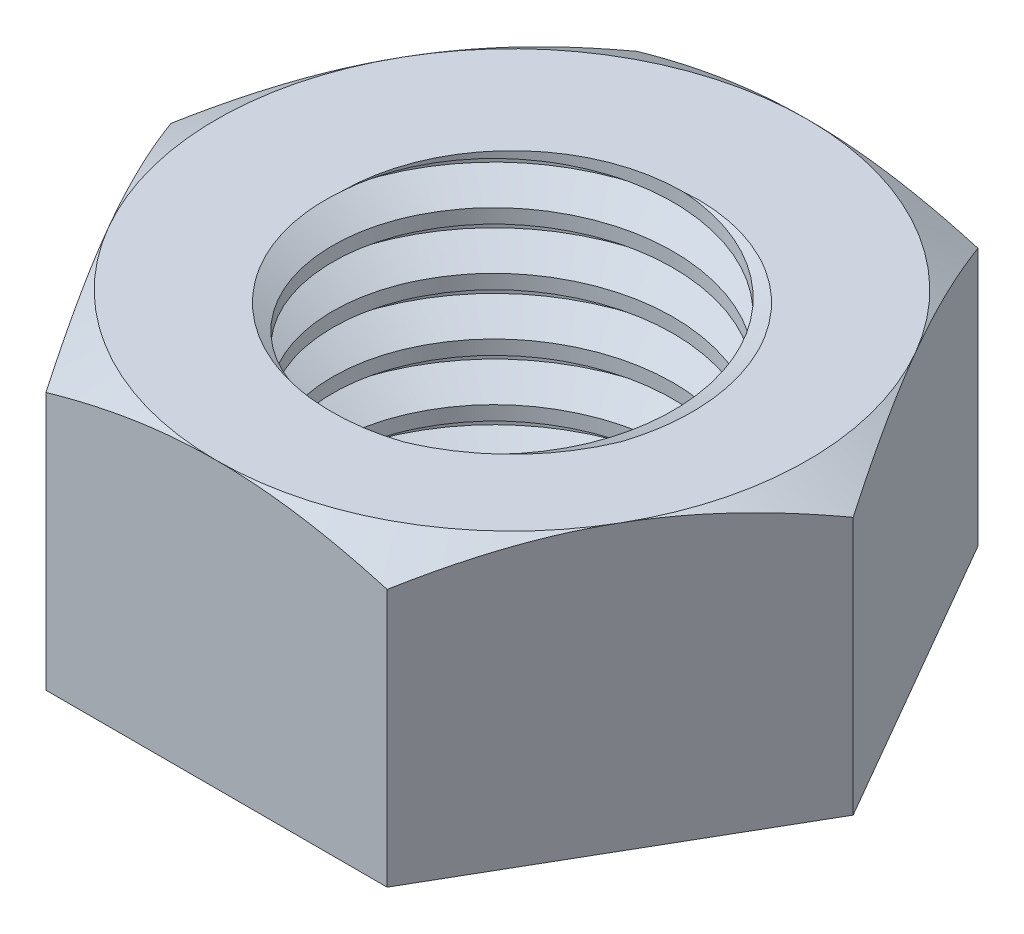
from build123d import *

# Parameters (mm, degrees)
BOSS_EXTRUDE1_DEPTH     = 10
CUT_EXTRUDE1_DEPTH      = 19.761663039
CUT_EXTRUDE1_DEPTH_BACK = 19.761663039
SKETCH3_R               = 6
THREAD1_PITCH           = 2


with BuildPart() as part:
    # Sketch1 → Boss-Extrude1 (new body)
    with BuildSketch(Plane(origin=(0, 0, 0), x_dir=(1, 0, 0), z_dir=(0, 1, 0))):
        Polygon((6, -10.392304845), (12, 0), (6, 10.392304845), (-6, 10.392304845), (-12, 0), (-6, -10.392304845), align=None)
    extrude(amount=BOSS_EXTRUDE1_DEPTH)

    # Sketch2 → Cut-Revolve1 (revolve, cut)
    with BuildSketch(Plane(origin=(0, 0, 0), x_dir=(0, 0, -1), z_dir=(1, 0, 0))):
        Polygon((10.392304845, 10), (13.856406461, 10), (13.856406461, 8), align=None)
    revolve(axis=Axis((0, 0, 0), (0, -1, 0)), mode=Mode.SUBTRACT)

    # Sketch3 → Cut-Extrude1 (cut, two sides: drawn at the far end of the back side and taken through both)
    with BuildSketch(Plane(origin=(0, 10, 0), x_dir=(1, 0, 0), z_dir=(0, 1, 0)).offset(-CUT_EXTRUDE1_DEPTH_BACK)):
        with Locations(Location((0, 0, 0), (0, 0, 270))):
            Circle(SKETCH3_R)
    extrude(amount=CUT_EXTRUDE1_DEPTH + CUT_EXTRUDE1_DEPTH_BACK, mode=Mode.SUBTRACT)

    # Thread1: the profile of Thread Profile1 profile screwed along a right-hand helix of 7 turns, 10 arcs to a turn; built about Z, then put on its axis
    thread1_z = Axis((0, 0, 0), (0, 0, 1))
    thread1_corners = [(5.9997, 0, -0.000173205), (7.08253175, 0, 0.624999997), (7.08253175, 0, 0.874999997), (5.9997, 0, 1.5001732)]
    with BuildLine(mode=Mode.PRIVATE) as thread1_profile:
        Line(thread1_corners[0], thread1_corners[1])
        Line(thread1_corners[1], thread1_corners[2])
        Line(thread1_corners[2], thread1_corners[3])
        Line(thread1_corners[3], thread1_corners[0])
    thread1_cap = Face(thread1_profile.wire())
    thread1_turn_angles = [0, 18, 36, 54, 72, 90, 108, 126, 144, 162, 180, 198, 216, 234, 252, 270, 288, 306, 324, 342, 360]
    thread1_turn_weights = [1, 0.9510565162951535, 1, 0.9510565162951535, 1, 0.9510565162951535, 1, 0.9510565162951535, 1, 0.9510565162951535, 1, 0.9510565162951535, 1, 0.9510565162951535, 1, 0.9510565162951535, 1, 0.9510565162951535, 1, 0.9510565162951535, 1]
    thread1_turn_rails = [Edge.make_bspline([Vector(p[0], p[1], 0).rotate(thread1_z, thread1_turn_angles[k]) / thread1_turn_weights[k] + Vector(0, 0, p[2] + THREAD1_PITCH * thread1_turn_angles[k] / 360) for k in range(21)], [0, 0, 0, 1, 1, 2, 2, 3, 3, 4, 4, 5, 5, 6, 6, 7, 7, 8, 8, 9, 9, 10, 10, 10], 2, thread1_turn_weights) for p in thread1_corners]
    thread1_turn_sides = [Face.make_surface_from_curves(thread1_turn_rails[p[0]], thread1_turn_rails[p[1]]) for p in [(0, 1), (1, 2), (2, 3), (3, 0)]]
    thread1 = Plane(origin=(0, 14, 0), x_dir=(-1, 0, 0), z_dir=(0, -1, 0)) * Solid(Shell([*[p.moved(Location((0, 0, THREAD1_PITCH * i))) for i in range(7) for p in thread1_turn_sides], thread1_cap, thread1_cap.rotate(thread1_z, 2520).moved(Location((0, 0, THREAD1_PITCH * 2520 / 360)))]))
    add(thread1, mode=Mode.SUBTRACT)


solid = part.part
